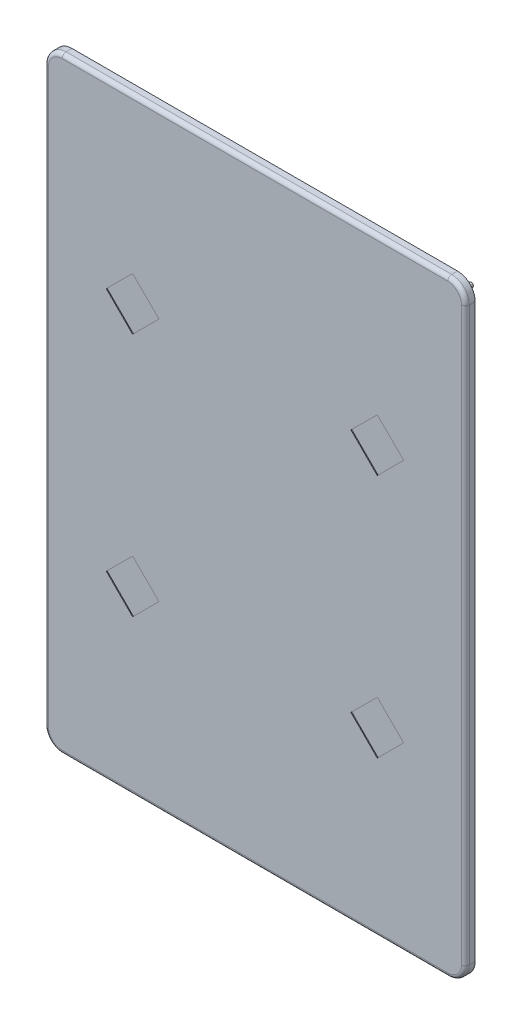
from build123d import *

# Parameters (mm, degrees)
SKETCH1_W           = 273.05
SKETCH1_H           = 393.7
BOSS_EXTRUDE1_DEPTH = 6.35
FILLET2_R           = 11.43
FILLET1_R           = 2.54
SKETCH2_R           = 1.397
BOSS_EXTRUDE2_DEPTH = 4.699
BOSS_EXTRUDE3_DEPTH = 6.35
CUT_EXTRUDE1_DEPTH  = 0.508


with BuildPart() as part:
    # Sketch1 → Boss-Extrude1 (new body)
    with BuildSketch(Plane.XY):
        with Locations((136.525, 196.85)):
            Rectangle(SKETCH1_W, SKETCH1_H)
    extrude(amount=BOSS_EXTRUDE1_DEPTH)

    # Fillet2
    fillet2_edges = [part.edges().sort_by_distance(p)[0] for p in [
        (0, 0, 3.175),
        (273.05, 0, 3.175),
        (0, 393.7, 3.175),
        (273.05, 393.7, 3.175),
    ]]
    fillet(fillet2_edges, radius=FILLET2_R)

    # Fillet1
    fillet1_edges = [part.edges().sort_by_distance(p)[0] for p in [
        (136.525, 393.7, 6.35),
        (273.05, 196.85, 6.35),
        (136.525, 0, 6.35),
        (0, 196.85, 6.35),
        (3.347769491, 390.352230509, 6.35),
        (269.702230509, 390.352230509, 6.35),
        (269.702230509, 3.347769491, 6.35),
        (3.347769491, 3.347769491, 6.35),
    ]]
    fillet(fillet1_edges, radius=FILLET1_R)

    # Sketch2 → Boss-Extrude2 (add)
    with BuildSketch(Plane(origin=(0, 0, 0), x_dir=(-1, 0, 0), z_dir=(0, 0, -1))):
        with Locations((-265.811, 385.826)):
            Circle(SKETCH2_R)
        with Locations((-136.525, 385.826)):
            Circle(SKETCH2_R)
        with Locations((-7.239, 385.826)):
            Circle(SKETCH2_R)
        with Locations((-7.239, 196.85)):
            Circle(SKETCH2_R)
        with Locations((-136.525, 7.874)):
            Circle(SKETCH2_R)
        with Locations((-7.239, 7.874)):
            Circle(SKETCH2_R)
        with Locations((-265.811, 196.85)):
            Circle(SKETCH2_R)
        with Locations((-265.811, 7.874)):
            Circle(SKETCH2_R)
    extrude(amount=BOSS_EXTRUDE2_DEPTH)

    # Sketch3 → Boss-Extrude3 (add)
    with BuildSketch(Plane(origin=(0, 9.779, 0), x_dir=(-1, 0, 0), z_dir=(0, -1, 0))):
        with BuildLine():
            Line((-240.03, 0), (-240.03, 0.254))
            Line((-240.03, 0.254), (-233.7435, 0.254))
            ThreePointArc((-233.7435, 0.254), (-233.204684633, 0.477184633), (-232.9815, 1.016))
            Line((-232.9815, 1.016), (-232.9815, 1.27))
            ThreePointArc((-232.9815, 1.27), (-230.9495, 3.302), (-228.9175, 1.27))
            Line((-228.9175, 1.27), (-228.9175, 1.016))
            ThreePointArc((-228.9175, 1.016), (-228.694315367, 0.477184633), (-228.1555, 0.254))
            Line((-228.1555, 0.254), (-221.869, 0.254))
            Line((-221.869, 0.254), (-221.869, 0))
            Line((-221.869, 0), (-240.03, 0))
        make_face()
    extrude(amount=-BOSS_EXTRUDE3_DEPTH)

    # Sketch4 → Cut-Extrude1 (cut)
    with BuildSketch(Plane.XY.offset(6.35)):
        Polygon((198.791738822, 276.225), (215.9, 293.241588949), (233.008261178, 276.225), (215.9, 259.116738822), align=None)
        Polygon((40.041738822, 276.225), (57.15, 293.241588949), (74.258261178, 276.225), (57.15, 259.116738822), align=None)
        Polygon((198.791738822, 117.475), (215.9, 134.491588949), (233.008261178, 117.475), (215.9, 100.366738822), align=None)
        Polygon((40.041738822, 117.475), (57.15, 134.491588949), (74.258261178, 117.475), (57.15, 100.366738822), align=None)
    extrude(amount=-CUT_EXTRUDE1_DEPTH, mode=Mode.SUBTRACT)


solid = part.part
